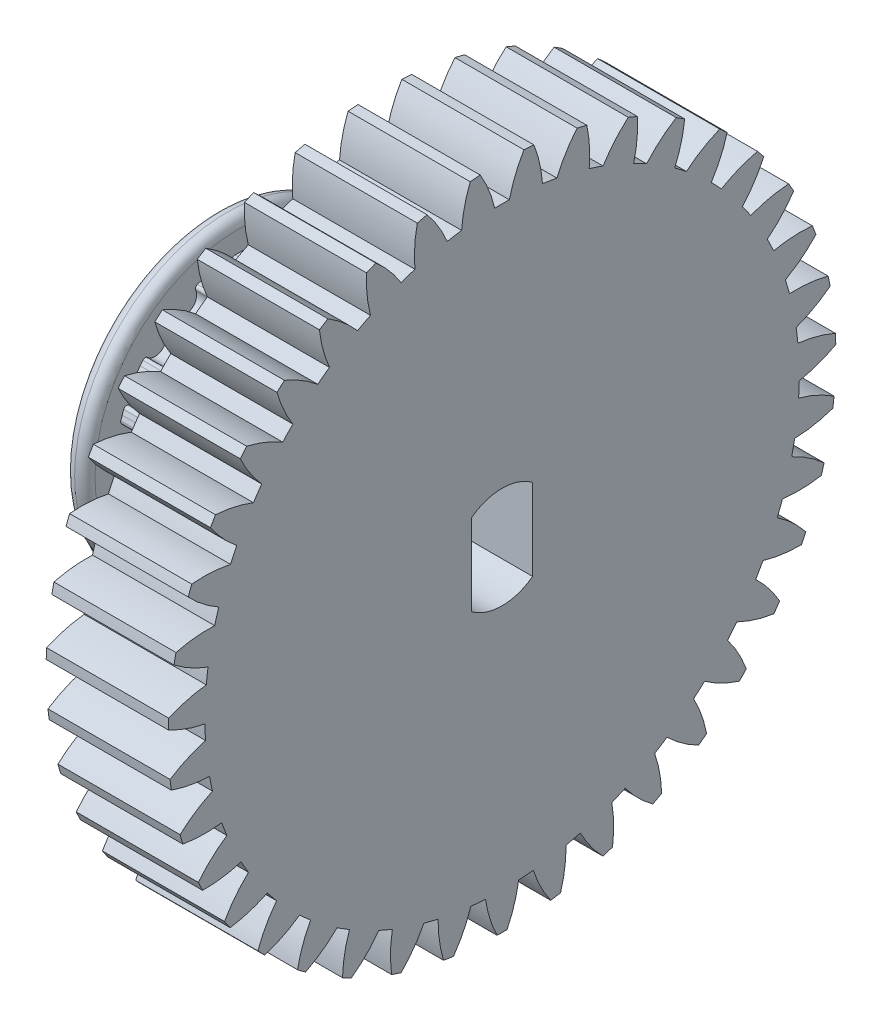
from build123d import *

# Parameters (mm, degrees)
BASPROSKE_W         = 6
BASPROSKE_H         = 16.4
TOOTHCUT_DEPTH      = 24.956627476
TEETHCUTS_COUNT     = 39
TEETHCUTS_ANGLE     = 350.769230769
BORSKE_R            = 2.5
BORE_DEPTH          = 50.0013716
SKETCH1_R           = 6.366
BOSS_EXTRUDE1_DEPTH = 7
CUT_EXTRUDE6_DEPTH  = 7
CIRPATTERN1_COUNT   = 20
SKETCH3_R           = 2.5
CUT_EXTRUDE7_DEPTH  = 7
SKETCH4_R           = 7.498589775
BOSS_EXTRUDE2_DEPTH = 1
FILLET1_R           = 0.5
SKETCH5_R           = 2.5
CUT_EXTRUDE8_DEPTH  = 1
BOSS_EXTRUDE3_START = -14
BOSS_EXTRUDE3_DEPTH = 14


with BuildPart() as part:
    # BasProSke → Base-Revolve (revolve)
    with BuildSketch(Plane(origin=(0, 0, 0), x_dir=(1, 0, 0), z_dir=(0, 1, 0)), mode=Mode.PRIVATE) as base_revolve_sk:
        with Locations((3, 8.2)):
            Rectangle(BASPROSKE_W, BASPROSKE_H)
    revolve(base_revolve_sk.sketch.rotate(Axis((-10, 0, 0), (1, 0, 0)), 180), axis=Axis((-10, 0, 0), (1, 0, 0)))

    # TooCutSke → ToothCut (cut, through all)
    with BuildSketch(Plane(origin=(0, 0, 0), x_dir=(0, 0, -1), z_dir=(1, 0, 0))):
        with BuildLine():
            ThreePointArc((0.35934894, 14.59457671), (0, 14.599), (-0.35934894, 14.59457671))
            ThreePointArc((-0.35934894, 14.59457671), (-0.653910463, 15.520403912), (-1.088613769, 16.389285684))
            ThreePointArc((-1.088613769, 16.389285684), (0, 16.4254), (1.088613769, 16.389285684))
            ThreePointArc((1.088613769, 16.389285684), (0.653910463, 15.520403912), (0.35934894, 14.59457671))
        make_face()
    toothcut = extrude(amount=TOOTHCUT_DEPTH, mode=Mode.SUBTRACT)

    # TeethCuts: ToothCut ×39 about axis
    teethcuts_axis = Axis((-10, 0, 0), (1, 0, 0))
    for i in range(1, TEETHCUTS_COUNT):
        add(toothcut.rotate(teethcuts_axis, i * TEETHCUTS_ANGLE / (TEETHCUTS_COUNT - 1)), mode=Mode.SUBTRACT)

    # BorSke → Bore (cut, symmetric)
    with BuildSketch(Plane(origin=(0, 0, 0), x_dir=(0, 0, -1), z_dir=(1, 0, 0))):
        with Locations(Location((0, 0, 0), (0, 0, 180))):
            Circle(BORSKE_R)
    extrude(amount=BORE_DEPTH, both=True, mode=Mode.SUBTRACT)

    # Sketch1 → Boss-Extrude1 (add)
    with BuildSketch(Plane.ZY):
        with Locations(Location((0, 0, 0), (0, 0, 180))):
            Circle(SKETCH1_R)
    extrude(amount=BOSS_EXTRUDE1_DEPTH)

    # Sketch2 → Cut-Extrude6 (cut)
    with BuildSketch(Plane.ZY.offset(7)):
        with BuildLine():
            Line((-0.099684631, 5.98516992), (0.118219414, 5.98516992))
            ThreePointArc((0.118219414, 5.98516992), (0.229925171, 5.935278979), (0.267322857, 5.818794235))
            ThreePointArc((0.267322857, 5.818794235), (0.737054825, 5.214163997), (1.355970437, 5.664907064))
            ThreePointArc((1.355970437, 5.664907064), (1.424189432, 5.766462226), (1.545347005, 5.783436473))
            Line((1.545347005, 5.783436473), (1.754713501, 5.723039099))
            Line((1.754713501, 5.723039099), (1.866105271, 6.086345958))
            Line((1.866105271, 6.086345958), (0.969630231, 6.365117226))
            Line((0.969630231, 6.365117226), (0.814035484, 6.414202026))
            Line((0.814035484, 6.414202026), (-0.106012757, 6.365117226))
            Line((-0.106012757, 6.365117226), (-0.099684631, 5.98516992))
        make_face()
    cut_extrude6 = extrude(amount=-CUT_EXTRUDE6_DEPTH, mode=Mode.SUBTRACT)

    # CirPattern1: Cut-Extrude6 ×20 about axis
    cirpattern1_axis = Axis((0, 0, 0), (1, 0, 0))
    for i in range(1, CIRPATTERN1_COUNT):
        add(cut_extrude6.rotate(cirpattern1_axis, i * 360 / CIRPATTERN1_COUNT), mode=Mode.SUBTRACT)

    # Sketch3 → Cut-Extrude7 (cut)
    with BuildSketch(Plane(origin=(0, 0, 0), x_dir=(0, 0, -1), z_dir=(1, 0, 0))):
        with Locations(Location((0, 0, 0), (0, 0, 180))):
            Circle(SKETCH3_R)
    extrude(amount=-CUT_EXTRUDE7_DEPTH, mode=Mode.SUBTRACT)

    # Sketch4 → Boss-Extrude2 (add)
    with BuildSketch(Plane.ZY.offset(7)):
        Circle(SKETCH4_R)
    extrude(amount=BOSS_EXTRUDE2_DEPTH)

    # Fillet1
    fillet1_edges = [part.edges().sort_by_distance(p)[0] for p in [
        (-7, 0, -7.498589775),
        (-8, 0, -7.498589775),
    ]]
    fillet(fillet1_edges, radius=FILLET1_R - 0.0001)  # a hair under: the kernel refuses the full size

    # Sketch5 → Cut-Extrude8 (cut)
    with BuildSketch(Plane(origin=(-7, 0, 0), x_dir=(0, 0, -1), z_dir=(1, 0, 0))):
        with Locations(Location((0, 0, 0), (0, 0, 180))):
            Circle(SKETCH5_R)
    extrude(amount=-CUT_EXTRUDE8_DEPTH, mode=Mode.SUBTRACT)

    # Sketch6 → Boss-Extrude3 (add)
    with BuildSketch(Plane.ZY.offset(8).offset(BOSS_EXTRUDE3_START)):
        with BuildLine():
            ThreePointArc((-1.5, 2), (-2.5, 0), (-1.5, -2))
            Line((-1.5, -2), (-1.5, 2))
        make_face()
        with BuildLine():
            Line((1.5, 2), (1.5, -2))
            ThreePointArc((1.5, -2), (2.236067977, -1.118033989), (2.5, 0))
            ThreePointArc((2.5, 0), (2.236067977, 1.118033989), (1.5, 2))
        make_face()
    extrude(amount=BOSS_EXTRUDE3_DEPTH)


solid = part.part
